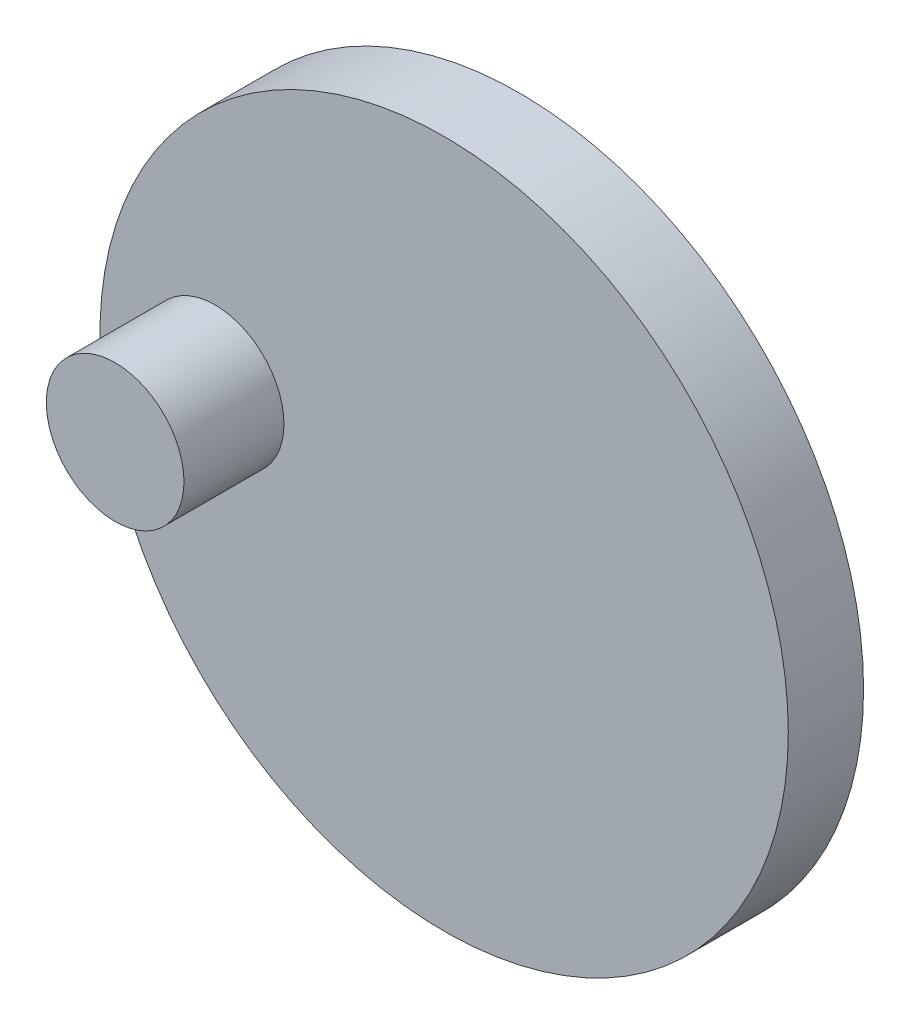
from build123d import *

# Parameters (mm, degrees)
EXTRUDE1_START       = -51.7398
EXTRUDE1_OUTLINE_R   = 101.6
EXTRUDE1_OUTLINE_R_2 = 20.320000135
EXTRUDE1_DEPTH       = 22.225
SKETCH2_R            = 20.320000135
EXTRUDE3_DEPTH       = 51.7398


# Read off the part's stored shape, not the designer's step: Extrude1
with BuildPart() as part:
    # Extrude1 outline → Extrude1 (new body)
    with BuildSketch(Plane.XY.offset(EXTRUDE1_START)):
        Circle(EXTRUDE1_OUTLINE_R)
        with Locations((-67.592977533, 4.400625988)):
            Circle(EXTRUDE1_OUTLINE_R_2, mode=Mode.SUBTRACT)
    extrude(amount=EXTRUDE1_DEPTH)

    # Sketch2 → Extrude3 (add, through all)
    with BuildSketch(Plane.XY):
        with Locations((-67.592977533, 4.400625988)):
            Circle(SKETCH2_R)
    extrude(amount=-EXTRUDE3_DEPTH)


solid = part.part
